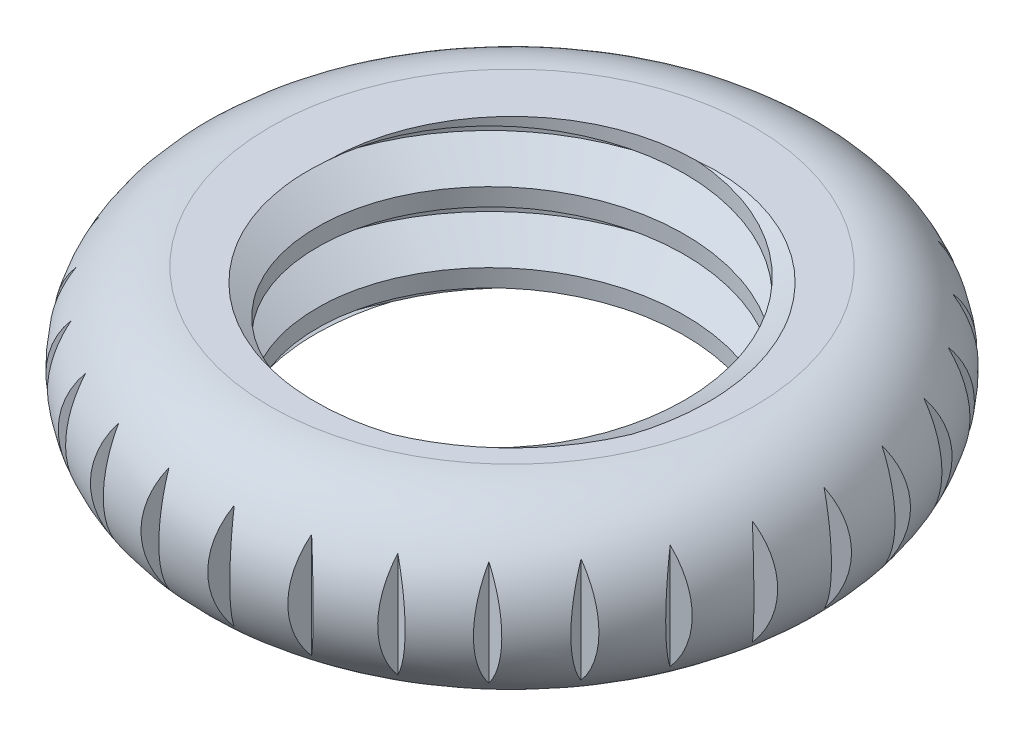
from build123d import *

# Parameters (mm, degrees)
CROQUIS1_R              = 9.4
SALIENTE_EXTRUIR1_DEPTH = 5
REDONDEO3_R             = 2.5
CORTAR_EXTRUIR3_DEPTH   = 5
MATRIZC1_COUNT          = 30
CROQUIS11_R             = 5.25
CORTAR_EXTRUIR5_DEPTH   = 55
ROSCA4_PITCH            = 2


with BuildPart() as part:
    # Croquis1 → Saliente-Extruir1 (new body)
    with BuildSketch(Plane(origin=(0, 0, 0), x_dir=(1, 0, 0), z_dir=(0, 1, 0))):
        with Locations(Location((0, 0, 0), (0, 0, 270))):
            Circle(CROQUIS1_R)
    extrude(amount=SALIENTE_EXTRUIR1_DEPTH)

    # Redondeo3
    redondeo3_edges = [part.edges().sort_by_distance(p)[0] for p in [
        (0, 0, -9.4),
        (0, 5, -9.4),
    ]]
    fillet(redondeo3_edges, radius=REDONDEO3_R - 0.0001)  # a hair under: the kernel refuses the full size

    # Croquis5 → Cortar-Extruir3 (cut)
    with BuildSketch(Plane(origin=(0, 5, 0), x_dir=(1, 0, 0), z_dir=(0, 1, 0))):
        Polygon((-8.9, 0), (-9.65, 0.433012702), (-9.65, -0.433012702), align=None)
    cortar_extruir3 = extrude(amount=-CORTAR_EXTRUIR3_DEPTH, mode=Mode.SUBTRACT)

    # MatrizC1: Cortar-Extruir3 ×30 about axis
    matrizc1_axis = Axis((0, 0, 0), (0, 1, 0))
    for i in range(1, MATRIZC1_COUNT):
        add(cortar_extruir3.rotate(matrizc1_axis, i * 360 / MATRIZC1_COUNT), mode=Mode.SUBTRACT)

    # Croquis11 → Cortar-Extruir5 (cut)
    with BuildSketch(Plane(origin=(0, 5, 0), x_dir=(1, 0, 0), z_dir=(0, 1, 0))):
        with Locations(Location((0, 0, 0), (0, 0, 270))):
            Circle(CROQUIS11_R)
    extrude(amount=-CORTAR_EXTRUIR5_DEPTH, mode=Mode.SUBTRACT)

    # Rosca4: the profile of Perfil de rosca4 profile screwed along a right-hand helix of 12 turns, 10 arcs to a turn; built about Z, then put on its axis
    rosca4_z = Axis((0, 0, 0), (0, 0, 1))
    rosca4_corners = [(5.2497, 0, -0.000173205), (6.33253175, 0, 0.624999997), (6.33253175, 0, 0.874999997), (5.2497, 0, 1.5001732)]
    with BuildLine(mode=Mode.PRIVATE) as rosca4_profile:
        Line(rosca4_corners[0], rosca4_corners[1])
        Line(rosca4_corners[1], rosca4_corners[2])
        Line(rosca4_corners[2], rosca4_corners[3])
        Line(rosca4_corners[3], rosca4_corners[0])
    rosca4_cap = Face(rosca4_profile.wire())
    rosca4_turn_angles = [0, 18, 36, 54, 72, 90, 108, 126, 144, 162, 180, 198, 216, 234, 252, 270, 288, 306, 324, 342, 360]
    rosca4_turn_weights = [1, 0.9510565162951535, 1, 0.9510565162951535, 1, 0.9510565162951535, 1, 0.9510565162951535, 1, 0.9510565162951535, 1, 0.9510565162951535, 1, 0.9510565162951535, 1, 0.9510565162951535, 1, 0.9510565162951535, 1, 0.9510565162951535, 1]
    rosca4_turn_rails = [Edge.make_bspline([Vector(p[0], p[1], 0).rotate(rosca4_z, rosca4_turn_angles[k]) / rosca4_turn_weights[k] + Vector(0, 0, p[2] + ROSCA4_PITCH * rosca4_turn_angles[k] / 360) for k in range(21)], [0, 0, 0, 1, 1, 2, 2, 3, 3, 4, 4, 5, 5, 6, 6, 7, 7, 8, 8, 9, 9, 10, 10, 10], 2, rosca4_turn_weights) for p in rosca4_corners]
    rosca4_turn_sides = [Face.make_surface_from_curves(rosca4_turn_rails[p[0]], rosca4_turn_rails[p[1]]) for p in [(0, 1), (1, 2), (2, 3), (3, 0)]]
    rosca4 = Plane(origin=(0, 7, 0), x_dir=(-1, 0, 0), z_dir=(0, -1, 0)) * Solid(Shell([*[p.moved(Location((0, 0, ROSCA4_PITCH * i))) for i in range(12) for p in rosca4_turn_sides], rosca4_cap, rosca4_cap.rotate(rosca4_z, 4320).moved(Location((0, 0, ROSCA4_PITCH * 4320 / 360)))]))
    add(rosca4, mode=Mode.SUBTRACT)


solid = part.part
